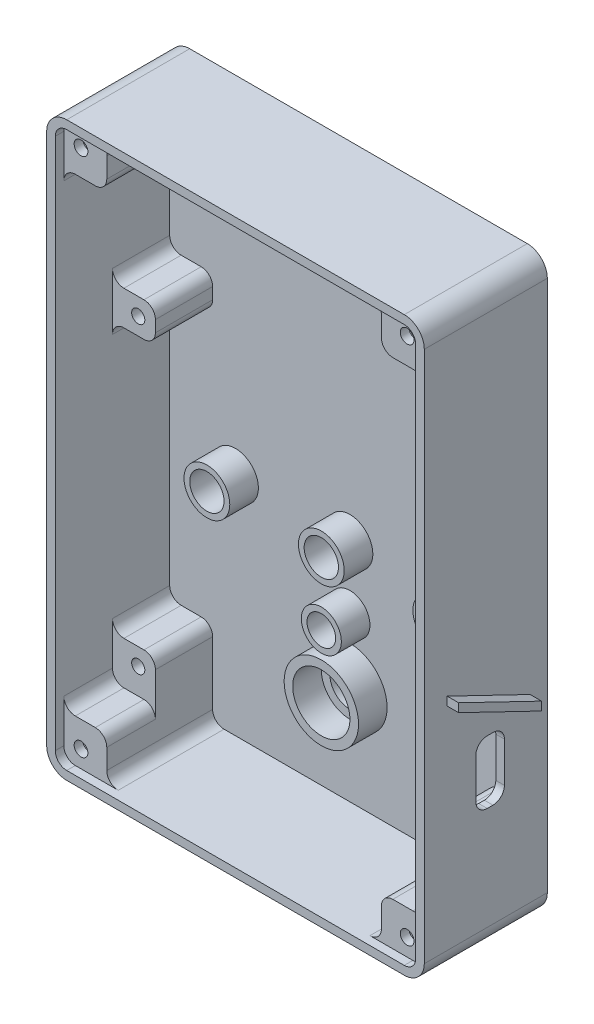
from build123d import *

# Parameters (mm, degrees)
SKETCH_1_W              = 66
SKETCH_1_H              = 100
SKETCH_1_W_2            = 63
SKETCH_1_H_2            = 97
EXTRUDE_1_DEPTH         = 20
SKETCH_3_W              = 66
SKETCH_3_H              = 100
EXTRUDE_2_DEPTH         = 1.5
SKETCH_4_W              = 7.5
SKETCH_4_H              = 6
SKETCH_4_H_2            = 7.5
EXTRUDE_3_DEPTH         = 10
HOLE_WIZARD_M2_21_D     = 2.3
HOLE_WIZARD_M2_21_DEPTH = 4
HOLE_WIZARD_M2_21_TIP   = 0.690989712
SKETCH_8_W              = 7.5
SKETCH_8_H              = 7.5
EXTRUDE_4_DEPTH         = 18.5
FILLET_1_R              = 2
FILLET_3_R              = 2
FILLET_4_R              = 3.5
SKETCH_9_R              = 3
SKETCH_9_R_2            = 2.5
SKETCH_9_R_3            = 3.5
CUT_EXTRUDE_1_DEPTH     = 64.158530699
EXTRUDE_START           = 5
SKETCH_10_R             = 4
SKETCH_10_R_2           = 3
SKETCH_10_R_3           = 3.5
SKETCH_10_R_4           = 2.5
EXTRUDE_5_DEPTH         = 5
SKETCH_11_R             = 2.5
CUT_EXTRUDE_2_DEPTH     = 18.5
HOLE_WIZARD_M21_D       = 2.4
SKETCH_15_W             = 5
SKETCH_15_H             = 11
CUT_EXTRUDE_3_DEPTH     = 85.025293811
FILLET_5_R              = 2
SKETCH_16_R             = 6.5
SKETCH_16_R_2           = 5
EXTRUDE_6_DEPTH         = 5
EXTRUDE_8_DEPTH         = 2


with BuildPart() as part:
    # Эскиз1 → Бобышка-Вытянуть1 (new body)
    with BuildSketch(Plane.XY):
        Rectangle(SKETCH_1_W, SKETCH_1_H)
        Rectangle(SKETCH_1_W_2, SKETCH_1_H_2, mode=Mode.SUBTRACT)
    extrude(amount=EXTRUDE_1_DEPTH)

    # Эскиз3 → Бобышка-Вытянуть2 (add)
    with BuildSketch(Plane(origin=(0, 0, 0), x_dir=(-1, 0, 0), z_dir=(0, 0, -1))):
        Rectangle(SKETCH_3_W, SKETCH_3_H)
    extrude(amount=EXTRUDE_2_DEPTH)

    # Эскиз4 → Бобышка-Вытянуть3 (add)
    with BuildSketch(Plane.XY):
        with Locations((-27.75, 16.5)):
            Rectangle(SKETCH_4_W, SKETCH_4_H)
        with Locations((27.75, 16.5)):
            Rectangle(SKETCH_4_W, SKETCH_4_H)
        with Locations((-27.75, -37.25)):
            Rectangle(SKETCH_4_W, SKETCH_4_H_2)
        with Locations((27.75, -37.25)):
            Rectangle(SKETCH_4_W, SKETCH_4_H_2)
    extrude(amount=EXTRUDE_3_DEPTH)

    # Сверло под метчик  спиральное M2.21
    with Locations(Plane.XY.offset(10)):
        with Locations((-27, 16.5), (27, 16.5), (27, -36.5), (-27, -36.5)):
            Hole(HOLE_WIZARD_M2_21_D / 2, depth=HOLE_WIZARD_M2_21_DEPTH)
            with Locations((0, 0, -(HOLE_WIZARD_M2_21_DEPTH + HOLE_WIZARD_M2_21_TIP / 2))):  # 118° drill point
                Cone(0, HOLE_WIZARD_M2_21_D / 2, HOLE_WIZARD_M2_21_TIP, mode=Mode.SUBTRACT)

    # Эскиз8 → Бобышка-Вытянуть4 (add)
    with BuildSketch(Plane.XY):
        with Locations((-27.75, 44.75)):
            Rectangle(SKETCH_8_W, SKETCH_8_H)
        with Locations((27.75, 44.75)):
            Rectangle(SKETCH_8_W, SKETCH_8_H)
        with Locations((27.75, -44.75)):
            Rectangle(SKETCH_8_W, SKETCH_8_H)
        with Locations((-27.75, -44.75)):
            Rectangle(SKETCH_8_W, SKETCH_8_H)
    extrude(amount=EXTRUDE_4_DEPTH)

    # Скругление1
    fillet_1_edges = [part.edges().sort_by_distance(p)[0] for p in [
        (-31.5, -33.5, 5),
        (-24, -33.5, 5),
        (-24, -48.5, 9.25),
        (24, -48.5, 9.25),
        (24, -33.5, 5),
        (31.5, -33.5, 5),
        (31.5, 13.5, 5),
        (24, 13.5, 5),
        (24, 19.5, 5),
        (31.5, 19.5, 5),
        (-31.5, 13.5, 5),
        (-24, 13.5, 5),
        (-24, 19.5, 5),
        (-31.5, 19.5, 5),
        (-31.5, 41, 9.25),
        (-24, 41, 9.25),
        (-24, 48.5, 9.25),
        (31.5, 41, 9.25),
        (24, 48.5, 9.25),
        (24, 41, 9.25),
    ]]
    fillet(fillet_1_edges, radius=FILLET_1_R)

    # Скругление3
    fillet_3_edges = [part.edges().sort_by_distance(p)[0] for p in [
        (-31.5, -48.5, 19.25),
        (-31.5, -41, 14.25),
        (-24, -41, 14.25),
        (31.5, -48.5, 19.25),
        (24, -41, 14.25),
        (31.5, -41, 14.25),
        (-31.5, 48.5, 19.25),
        (31.5, 48.5, 19.25),
    ]]
    fillet(fillet_3_edges, radius=FILLET_3_R)

    # Скругление4
    fillet_4_edges = [part.edges().sort_by_distance(p)[0] for p in [
        (-33, -50, 9.25),
        (33, -50, 9.25),
        (33, 50, 9.25),
        (-33, 50, 9.25),
    ]]
    fillet(fillet_4_edges, radius=FILLET_4_R)

    # Эскиз9 → Вырез-Вытянуть1 (cut, through all)
    with BuildSketch(Plane.XY):
        with Locations((-20, -9)):
            Circle(SKETCH_9_R)
        with Locations((20, -9)):
            Circle(SKETCH_9_R)
        with Locations((0, -20)):
            Circle(SKETCH_9_R_2)
        with Locations((0, -9)):
            Circle(SKETCH_9_R)
        with Locations((0, -31)):
            Circle(SKETCH_9_R_3)
    extrude(amount=-CUT_EXTRUDE_1_DEPTH, mode=Mode.SUBTRACT)

    # Эскиз10 → Бобышка-Вытянуть5 (add)
    # profile 1 of 4: a face of its own
    with BuildSketch(Plane.XY.offset(EXTRUDE_START)):
        with Locations((0, -9)):
            Circle(SKETCH_10_R)
        with Locations((0, -9)):
            Circle(SKETCH_10_R_2, mode=Mode.SUBTRACT)
    # profile 2 of 4: a face of its own
    with BuildSketch(Plane.XY.offset(EXTRUDE_START)):
        with Locations((20, -9)):
            Circle(SKETCH_10_R)
        with Locations((20, -9)):
            Circle(SKETCH_10_R_2, mode=Mode.SUBTRACT)
    # profile 3 of 4: a face of its own
    with BuildSketch(Plane.XY.offset(EXTRUDE_START)):
        with Locations((0, -20)):
            Circle(SKETCH_10_R_3)
        with Locations((0, -20)):
            Circle(SKETCH_10_R_4, mode=Mode.SUBTRACT)
    # profile 4 of 4: a face of its own
    with BuildSketch(Plane.XY.offset(EXTRUDE_START)):
        with Locations((-20, -9)):
            Circle(SKETCH_10_R)
        with Locations((-20, -9)):
            Circle(SKETCH_10_R_2, mode=Mode.SUBTRACT)
    extrude(amount=-EXTRUDE_5_DEPTH)

    # Эскиз11 → Вырез-Вытянуть2 (cut)
    with BuildSketch(Plane(origin=(0, 0, -1.5), x_dir=(-1, 0, 0), z_dir=(0, 0, -1))):
        with Locations((-28.5, 45.5)):
            Circle(SKETCH_11_R)
        with Locations((28.5, 45.5)):
            Circle(SKETCH_11_R)
        with Locations((28.5, -45.5)):
            Circle(SKETCH_11_R)
        with Locations((-28.5, -45.5)):
            Circle(SKETCH_11_R)
    extrude(amount=-CUT_EXTRUDE_2_DEPTH, mode=Mode.SUBTRACT)

    # Отверстие с зазором M21 (through all)
    with Locations(Plane(origin=(0, 0, 17), x_dir=(-1, 0, 0), z_dir=(0, 0, -1))):
        with Locations((-28.5, 45.5), (28.5, 45.5), (28.5, -45.5), (-28.5, -45.5)):
            Hole(HOLE_WIZARD_M21_D / 2)

    # Эскиз15 → Вырез-Вытянуть3 (cut, through all)
    with BuildSketch(Plane.ZY.offset(-31.5)):
        with Locations((8.5, -23)):
            Rectangle(SKETCH_15_W, SKETCH_15_H)
    extrude(amount=-CUT_EXTRUDE_3_DEPTH, mode=Mode.SUBTRACT)

    # Скругление5
    fillet_5_edges = [part.edges().sort_by_distance(p)[0] for p in [
        (32.25, -28.5, 11),
        (32.25, -17.5, 11),
        (32.25, -17.5, 6),
        (32.25, -28.5, 6),
    ]]
    fillet(fillet_5_edges, radius=FILLET_5_R)

    # Эскиз16 → Бобышка-Вытянуть6 (add)
    with BuildSketch(Plane.XY):
        with Locations((0, -31)):
            Circle(SKETCH_16_R)
        with Locations((0, -31)):
            Circle(SKETCH_16_R_2, mode=Mode.SUBTRACT)
    extrude(amount=EXTRUDE_6_DEPTH)

    # Эскиз20 → Бобышка-Вытянуть8 (add)
    with BuildSketch(Plane(origin=(33, 0, 0), x_dir=(0, 0, -1), z_dir=(1, 0, 0))):
        Polygon((-16, -9.5), (-16, -8), (-1.5, -15), (-1.5, -16.5), align=None)
    extrude(amount=EXTRUDE_8_DEPTH)


solid = part.part
